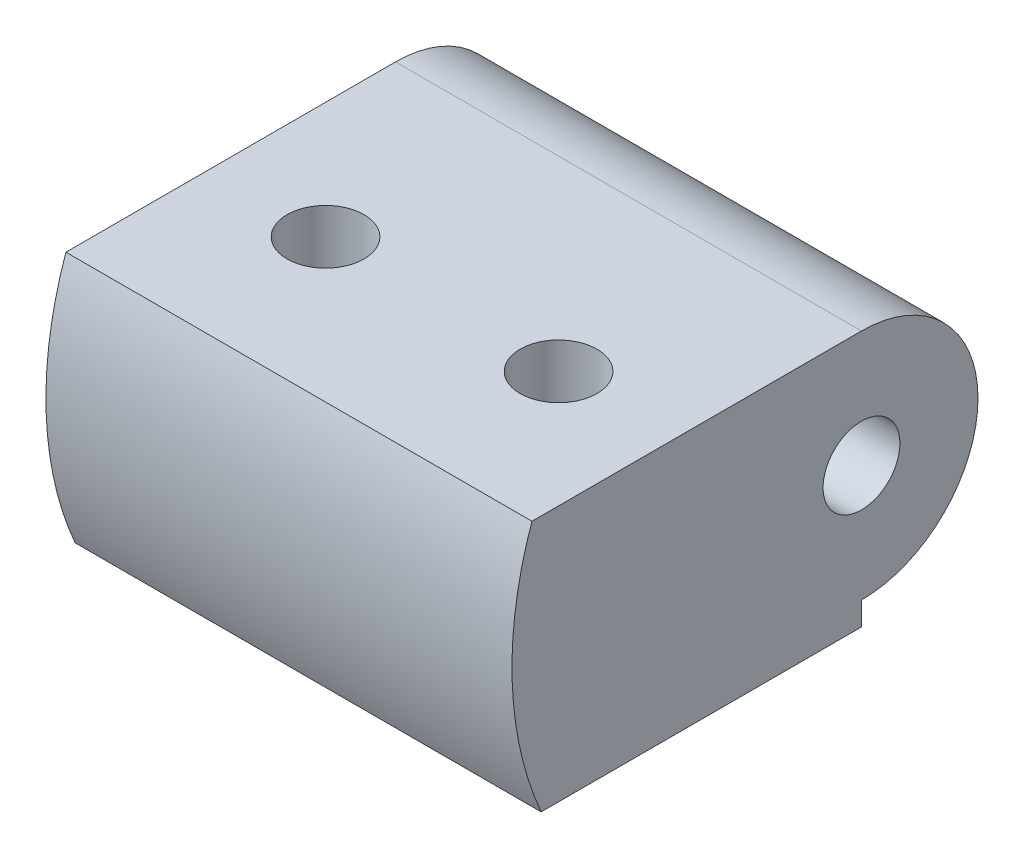
from build123d import *

# Parameters (mm, degrees)
SKETCH1_W             = 20
SKETCH1_H             = 20
BOSS_EXTRUDE1_DEPTH   = 10
FILLET1_R             = 5
M4X0_7_TAPPED_HOLE1_D = 3.3
SKETCH14_W            = 20
SKETCH14_H            = 15
BOSS_EXTRUDE4_DEPTH   = 1
M4X0_7_TAPPED_HOLE2_D = 3.3
CUT_EXTRUDE1_DEPTH    = 25.494897428


with BuildPart() as part:
    # Sketch1 → Boss-Extrude1 (new body)
    with BuildSketch(Plane(origin=(0, 0, 0), x_dir=(1, 0, 0), z_dir=(0, 1, 0))):
        Rectangle(SKETCH1_W, SKETCH1_H)
    extrude(amount=BOSS_EXTRUDE1_DEPTH)

    # Fillet1
    fillet1_edges = [part.edges().sort_by_distance(p)[0] for p in [
        (0, 0, -10),
        (0, 10, -10),
    ]]
    fillet(fillet1_edges, radius=FILLET1_R - 0.0001)  # a hair under: the kernel refuses the full size

    # M4x0.7 Tapped Hole1 (through all)
    with Locations(Plane(origin=(10, 0, 0), x_dir=(0, 0, -1), z_dir=(1, 0, 0))):
        with Locations((5, 5)):
            Hole(M4X0_7_TAPPED_HOLE1_D / 2)

    # Sketch14 → Boss-Extrude4 (add)
    with BuildSketch(Plane.XZ):
        with Locations((0, 2.5)):
            Rectangle(SKETCH14_W, SKETCH14_H)
    extrude(amount=BOSS_EXTRUDE4_DEPTH)

    # M4x0.7 Tapped Hole2 (through all)
    with Locations(Plane(origin=(0, 10, 0), x_dir=(1, 0, 0), z_dir=(0, 1, 0))):
        with Locations((-5, -3), (5, -3)):
            Hole(M4X0_7_TAPPED_HOLE2_D / 2)

    # Sketch9 → Cut-Extrude1 (cut, through all)
    with BuildSketch(Plane(origin=(10, 0, 0), x_dir=(0, 0, -1), z_dir=(1, 0, 0))):
        with BuildLine():
            ThreePointArc((-10, 5), (-9.783978395, 7.536529681), (-9.142135624, 10))
            Line((-9.142135624, 10), (-10, 10))
            Line((-10, 10), (-10, 5))
        make_face()
        with BuildLine():
            Line((-10, 0), (-9.142135624, 0))
            ThreePointArc((-9.142135624, 0), (-9.783978395, 2.463470319), (-10, 5))
            Line((-10, 5), (-10, 0))
        make_face()
        with BuildLine():
            Line((-10, -1), (-8.747727085, -1))
            ThreePointArc((-8.747727085, -1), (-8.953892306, -0.503534276), (-9.142135624, 0))
            Line((-9.142135624, 0), (-10, 0))
            Line((-10, 0), (-10, -1))
        make_face()
    extrude(amount=-CUT_EXTRUDE1_DEPTH, mode=Mode.SUBTRACT)


solid = part.part
